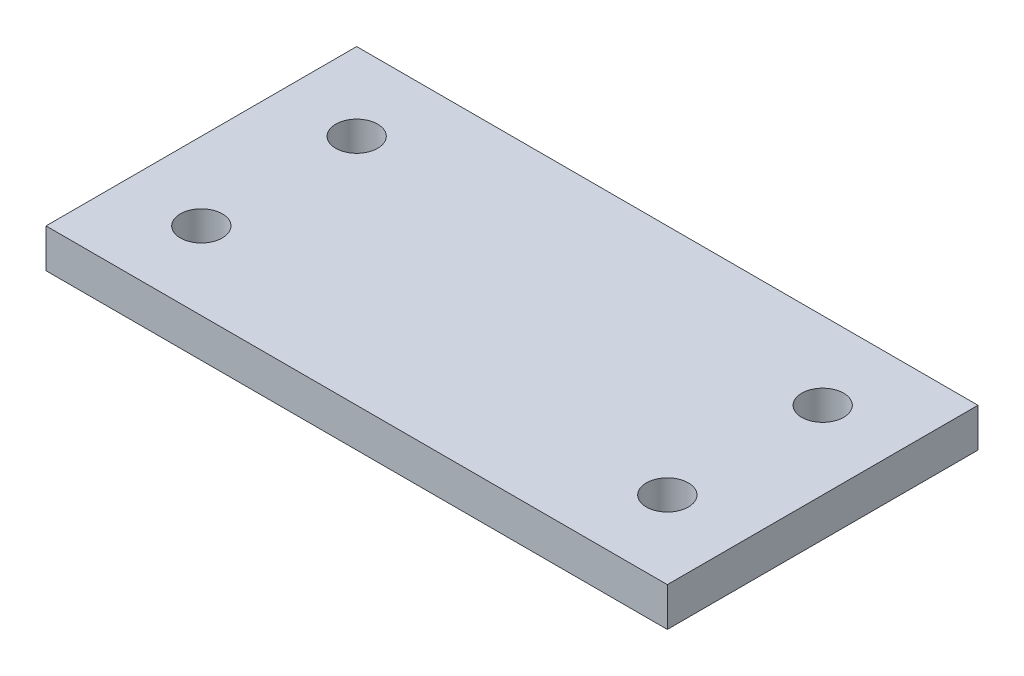
from build123d import *

# Parameters (mm, degrees)
SKETCH1_W           = 101.6
SKETCH1_H           = 50.8
BOSS_EXTRUDE1_DEPTH = 6.35
CUT_EXTRUDE2_REACH  = 59.15
SKETCH3_R           = 3.429


with BuildPart() as part:
    # Sketch1 → Boss-Extrude1 (new body)
    with BuildSketch(Plane(origin=(0, 0, 0), x_dir=(1, 0, 0), z_dir=(0, 1, 0))):
        Rectangle(SKETCH1_W, SKETCH1_H)
    extrude(amount=BOSS_EXTRUDE1_DEPTH)

    # Sketch3 → Cut-Extrude2 (cut, up to next)
    with BuildSketch(Plane.XZ, mode=Mode.PRIVATE) as cut_extrude2_sk1:
        with Locations((-38.1, 12.7)):
            Circle(SKETCH3_R)
    cut_extrude2_tool1 = extrude(cut_extrude2_sk1.sketch, amount=-CUT_EXTRUDE2_REACH, mode=Mode.PRIVATE) & part.part
    # Sketch3 → Cut-Extrude2 (cut, up to next)
    with BuildSketch(Plane.XZ, mode=Mode.PRIVATE) as cut_extrude2_sk2:
        with Locations((-38.1, -12.7)):
            Circle(SKETCH3_R)
    cut_extrude2_tool2 = extrude(cut_extrude2_sk2.sketch, amount=-CUT_EXTRUDE2_REACH, mode=Mode.PRIVATE) & part.part
    # Sketch3 → Cut-Extrude2 (cut, up to next)
    with BuildSketch(Plane.XZ, mode=Mode.PRIVATE) as cut_extrude2_sk3:
        with Locations((38.1, 12.7)):
            Circle(SKETCH3_R)
    cut_extrude2_tool3 = extrude(cut_extrude2_sk3.sketch, amount=-CUT_EXTRUDE2_REACH, mode=Mode.PRIVATE) & part.part
    # Sketch3 → Cut-Extrude2 (cut, up to next)
    with BuildSketch(Plane.XZ, mode=Mode.PRIVATE) as cut_extrude2_sk4:
        with Locations((38.1, -12.7)):
            Circle(SKETCH3_R)
    cut_extrude2_tool4 = extrude(cut_extrude2_sk4.sketch, amount=-CUT_EXTRUDE2_REACH, mode=Mode.PRIVATE) & part.part
    add(cut_extrude2_tool1.solids().sort_by_distance((-38.1, 0, 12.7))[0], mode=Mode.SUBTRACT)
    add(cut_extrude2_tool2.solids().sort_by_distance((-38.1, 0, -12.7))[0], mode=Mode.SUBTRACT)
    add(cut_extrude2_tool3.solids().sort_by_distance((38.1, 0, 12.7))[0], mode=Mode.SUBTRACT)
    add(cut_extrude2_tool4.solids().sort_by_distance((38.1, 0, -12.7))[0], mode=Mode.SUBTRACT)


solid = part.part
